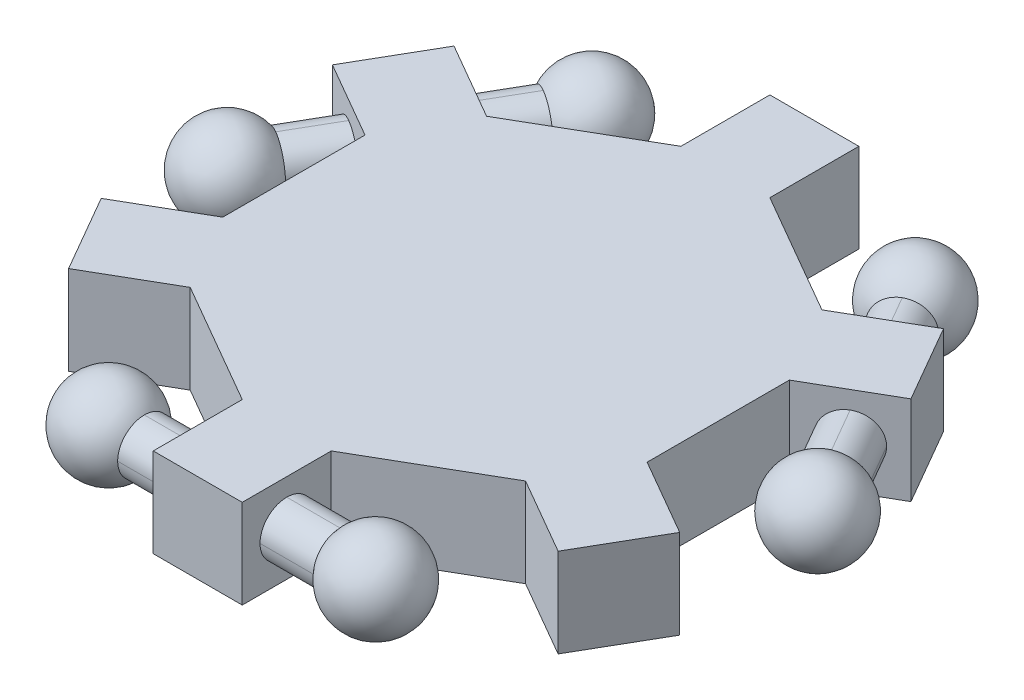
from build123d import *

# Parameters (mm, degrees)
BOSS_EXTRUDE1_DEPTH = 10
SKETCH3_W           = 6
SKETCH3_H           = 6
BOSS_EXTRUDE2_DEPTH = 10
FILLET1_R           = 3


with BuildPart() as part:
    # Sketch2 → Boss-Extrude1 (new body)
    with BuildSketch(Plane(origin=(0, 0, 0), x_dir=(1, 0, 0), z_dir=(0, 1, 0))):
        Polygon((153.500000001, 139.641016152), (143.5, 139.641016152), (143.5, 129.641016152), (129.660254038, 121.650635095), (121, 126.650635095), (116, 117.990381057), (128.990381057, 110.490381057), (124.660254038, 97.009618943), (116, 92.009618943), (121, 83.349364905), (129.660254038, 88.349364905), (143.499999999, 80.358983848), (143.499999999, 70.358983848), (153.5, 70.358983848), (153.5, 80.358983848), (167.339745962, 88.349364905), (176, 83.349364905), (181, 92.009618944), (172.339745963, 97.009618944), (172.339745963, 112.990381057), (181.000000001, 117.990381057), (176.000000001, 126.650635095), (167.339745963, 121.650635095), (153.500000001, 129.641016152), align=None)
    extrude(amount=BOSS_EXTRUDE1_DEPTH)

    # Sketch3 → Boss-Extrude2 (add)
    with BuildSketch(Plane(origin=(153.5, 0, 0), x_dir=(0, 0, -1), z_dir=(1, 0, 0))):
        with Locations((75.358983848, 5)):
            Rectangle(SKETCH3_W, SKETCH3_H)
    extrude(amount=BOSS_EXTRUDE2_DEPTH)

    # Fillet1
    fillet1_edges = [part.edges().sort_by_distance(p)[0] for p in [
        (158.5, 8, -72.358983848),
        (158.5, 2, -72.358983848),
        (158.5, 2, -78.358983848),
        (158.5, 8, -78.358983848),
    ]]
    fillet(fillet1_edges, radius=FILLET1_R - 0.0001)  # a hair under: the kernel refuses the full size

    # Sketch4 → Revolve1 (revolve)
    with BuildSketch(Plane(origin=(163.5, 0, 0), x_dir=(0, 0, -1), z_dir=(1, 0, 0))):
        with BuildLine():
            Line((70.358983848, 5), (80.358983848, 5))
            ThreePointArc((80.358983848, 5), (75.358983848, 10), (70.358983848, 5))
        make_face()
    revolve(axis=Axis((163.5, 5, -70.358983848), (0, 0, -1)))

    # Mirror1: part across plane


with BuildPart() as part_1:
    add(part.part)
    add(part.part.mirror(Plane.ZY.offset(-148.500000001)))

    # Mirror2: part across plane


with BuildPart() as part_2:
    add(part_1.part)
    add(part_1.part.mirror(Plane(origin=(-8.3413337, 0, -14.447613772), x_dir=(-0.8660254037935928, 0, 0.4999999999841444), z_dir=(0.4999999999841445, 0, 0.8660254037935928))))

    # Mirror3: part across plane


with BuildPart() as part_3:
    add(part_2.part)
    add(part_2.part.mirror(Plane.ZY.offset(-148.500000001)))


solid = part_3.part
